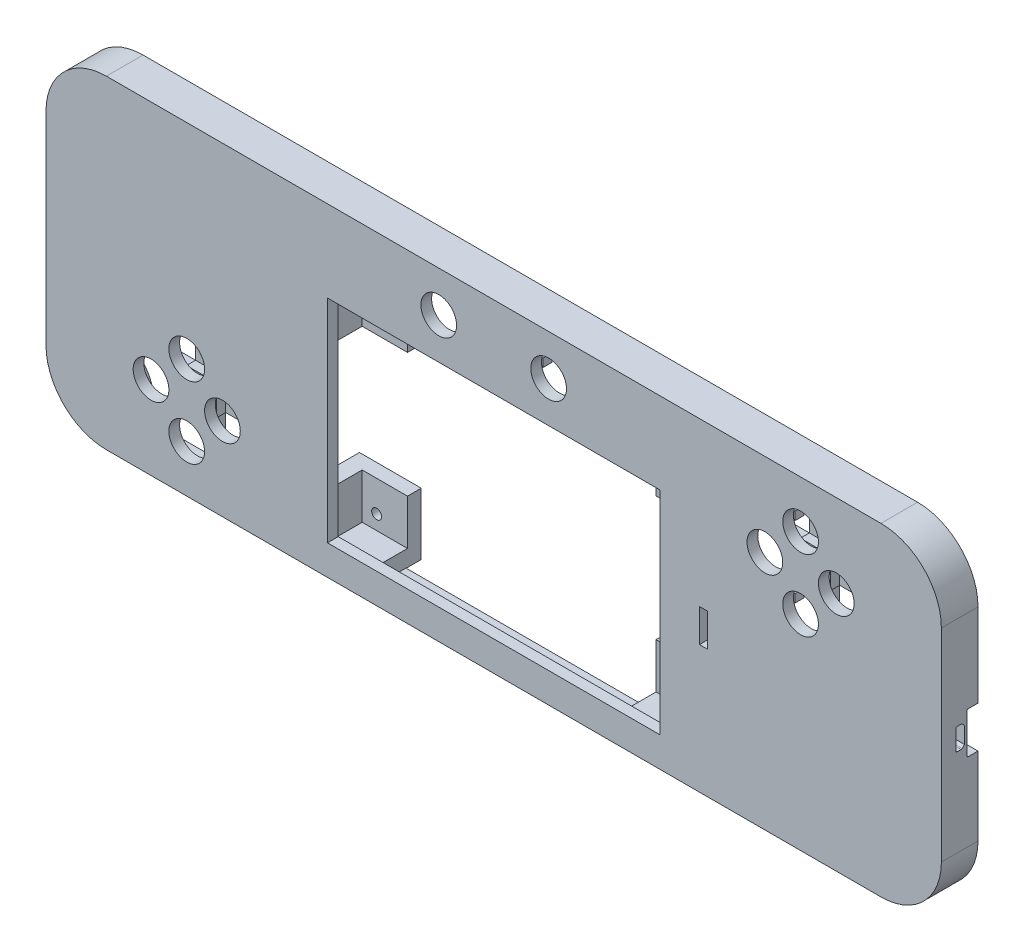
from build123d import *
from OCP.BRepAlgoAPI import BRepAlgoAPI_Cut
from OCP.TopTools import TopTools_ListOfShape

# Parameters (mm, degrees)
BOSS_EXTRUDE1_START  = 12
BOSS_EXTRUDE1_DEPTH  = 13.331287921
BOSS_EXTRUDE2_START  = 12
SKETCH1_3_W          = 121
SKETCH1_3_H          = 77.2
BOSS_EXTRUDE2_DEPTH  = 3.9
CUT_EXTRUDE1_START   = 12
SKETCH2_R            = 6.5
CUT_EXTRUDE1_DEPTH   = 3.9
CUT_EXTRUDE3_START   = 163.1
CUT_EXTRUDE3_DEPTH   = 3.9
CUT_EXTRUDE4_START   = 8.1
SKETCH5_W            = 70
SKETCH5_H            = 53.168839264
CUT_EXTRUDE4_DEPTH   = 1.8
BOSS_EXTRUDE3_START  = 8.1
BOSS_EXTRUDE3_DEPTH  = 15
BOSS_EXTRUDE4_START  = -6.9
SKETCH6_4_W          = 16.5
SKETCH6_4_H          = 16.5
SKETCH6_4_R          = 1.8
BOSS_EXTRUDE4_DEPTH  = 5
CUT_EXTRUDE5_START   = -59.9
SKETCH7_R            = 6.5
CUT_EXTRUDE5_DEPTH   = 3.9
BOSS_EXTRUDE7_START  = 8.1
SKETCH8_W            = 4
SKETCH8_H            = 3
SKETCH8_W_2          = 3
SKETCH8_H_2          = 4
SKETCH8_W_3          = 8
SKETCH8_H_3          = 4.95
BOSS_EXTRUDE7_DEPTH  = 3.3
BOSS_EXTRUDE8_START  = 4.8
SKETCH8_3_W          = 8
SKETCH8_3_H          = 5
SKETCH8_3_W_2        = 5
SKETCH8_3_H_2        = 8
SKETCH8_3_H_3        = 4
SKETCH8_3_H_4        = 4.95
BOSS_EXTRUDE8_DEPTH  = 3
BOSS_EXTRUDE9_START  = 9.9
SKETCH9_W            = 6.735111263
SKETCH9_H            = 18.572579543
SKETCH9_W_2          = 6.849276862
SKETCH9_H_2          = 17.65415528
BOSS_EXTRUDE9_DEPTH  = 5.88
BOSS_EXTRUDE10_START = 8.1
SKETCH9_4_W          = 7.5
SKETCH9_4_H          = 39.329891822
BOSS_EXTRUDE10_DEPTH = 4.88
CUT_EXTRUDE6_START   = 1.414648
SKETCH10_W           = 3
SKETCH10_H           = 12
CUT_EXTRUDE6_DEPTH   = 3.9
BOSS_EXTRUDE11_START = -1.331288
SKETCH11_R           = 4
BOSS_EXTRUDE11_DEPTH = 11.231288


with BuildPart() as part:
    # Sketch1 → Boss-Extrude1 (new body)
    with BuildSketch(Plane.XY.offset(BOSS_EXTRUDE1_START)):
        with BuildLine():
            Line((-162.9, -37.9), (-162.9, 35.9))
            ThreePointArc((-162.9, 35.9), (-156.456349186, 51.456349186), (-140.9, 57.9))
            Line((-140.9, 57.9), (141.1, 57.9))
            ThreePointArc((141.1, 57.9), (156.656349186, 51.456349186), (163.1, 35.9))
            Line((163.1, 35.9), (163.1, -37.9))
            ThreePointArc((163.1, -37.9), (156.656349186, -53.456349186), (141.1, -59.9))
            Line((141.1, -59.9), (-140.9, -59.9))
            ThreePointArc((-140.9, -59.9), (-156.456349186, -53.456349186), (-162.9, -37.9))
        make_face()
        with BuildLine():
            Line((137.2, -56), (-137, -56))
            ThreePointArc((-137, -56), (-152.556349186, -49.556349186), (-159, -34))
            Line((-159, -34), (-159, 32))
            ThreePointArc((-159, 32), (-152.556349186, 47.556349186), (-137, 54))
            Line((-137, 54), (137.2, 54))
            ThreePointArc((137.2, 54), (152.756349186, 47.556349186), (159.2, 32))
            Line((159.2, 32), (159.2, -34))
            ThreePointArc((159.2, -34), (152.756349186, -49.556349186), (137.2, -56))
        make_face(mode=Mode.SUBTRACT)
    extrude(amount=-BOSS_EXTRUDE1_DEPTH)

    # Sketch1<3> → Boss-Extrude2 (add)
    with BuildSketch(Plane.XY.offset(BOSS_EXTRUDE2_START)):
        with BuildLine():
            ThreePointArc((-137, -56), (-152.556349186, -49.556349186), (-159, -34))
            Line((-159, -34), (-159, 32))
            ThreePointArc((-159, 32), (-152.556349186, 47.556349186), (-137, 54))
            Line((-137, 54), (137.2, 54))
            ThreePointArc((137.2, 54), (152.756349186, 47.556349186), (159.2, 32))
            Line((159.2, 32), (159.2, -34))
            ThreePointArc((159.2, -34), (152.756349186, -49.556349186), (137.2, -56))
            Line((137.2, -56), (-137, -56))
        make_face()
        with Locations((0.073350115, -10.4)):
            Rectangle(SKETCH1_3_W, SKETCH1_3_H, mode=Mode.SUBTRACT)
    extrude(amount=-BOSS_EXTRUDE2_DEPTH)

    # Sketch2 → Cut-Extrude1 (cut)
    with BuildSketch(Plane.XY.offset(CUT_EXTRUDE1_START)):
        with Locations((111.836675057, 14.644432636)):
            Circle(SKETCH2_R)
        with Locations((98.836675057, 27.644432636)):
            Circle(SKETCH2_R)
        with Locations((111.836675057, 40.644432636)):
            Circle(SKETCH2_R)
        with Locations((124.836675057, 27.644432636)):
            Circle(SKETCH2_R)
        with Locations((20.1, 43.05)):
            Circle(SKETCH2_R)
        with Locations((-111.663324943, -42.644432636)):
            Circle(SKETCH2_R)
        with Locations((-124.663324943, -29.644432636)):
            Circle(SKETCH2_R)
        with Locations((-98.663324943, -29.644432636)):
            Circle(SKETCH2_R)
        with Locations((-111.663324943, -16.644432636)):
            Circle(SKETCH2_R)
        with Locations((-19.9, 43.05)):
            Circle(SKETCH2_R)
    extrude(amount=-CUT_EXTRUDE1_DEPTH, mode=Mode.SUBTRACT)

    # Sketch4 → Cut-Extrude3 (cut)
    with BuildSketch(Plane(origin=(0, 0, 0), x_dir=(0, 0, -1), z_dir=(1, 0, 0)).offset(CUT_EXTRUDE3_START)):
        with BuildLine():
            Line((-6.205473314, -6), (-4.820792559, -6))
            ThreePointArc((-4.820792559, -6), (-4.623827102, -5.962796787), (-4.454001452, -5.856313365))
            Line((-4.454001452, -5.856313365), (-3.605473314, -5.007785228))
            Line((-3.605473314, -5.007785228), (-3.605473314, 1.007785228))
            Line((-3.605473314, 1.007785228), (-4.454001452, 1.856313365))
            ThreePointArc((-4.454001452, 1.856313365), (-4.623827102, 1.962796787), (-4.820792559, 2))
            Line((-4.820792559, 2), (-6.205473314, 2))
            ThreePointArc((-6.205473314, 2), (-6.559026705, 1.853553391), (-6.705473314, 1.5))
            Line((-6.705473314, 1.5), (-6.705473314, -5.5))
            ThreePointArc((-6.705473314, -5.5), (-6.559026705, -5.853553391), (-6.205473314, -6))
        make_face()
        with BuildLine():
            Line((-2.698712079, -9.05), (-2.698712079, 5.05))
            ThreePointArc((-2.698712079, 5.05), (-2.552265469, 5.403553391), (-2.198712079, 5.55))
            Line((-2.198712079, 5.55), (4.705469512, 5.55))
            ThreePointArc((4.705469512, 5.55), (5.059022903, 5.403553391), (5.205469512, 5.05))
            Line((5.205469512, 5.05), (5.205469512, -9.05))
            ThreePointArc((5.205469512, -9.05), (5.059022903, -9.403553391), (4.705469512, -9.55))
            Line((4.705469512, -9.55), (-2.198712079, -9.55))
            ThreePointArc((-2.198712079, -9.55), (-2.552265469, -9.403553391), (-2.698712079, -9.05))
        make_face()
    extrude(amount=-CUT_EXTRUDE3_DEPTH, mode=Mode.SUBTRACT)

    # Sketch5 → Cut-Extrude4 (cut)
    with BuildSketch(Plane.XY.offset(CUT_EXTRUDE4_START)):
        with Locations((115.058285802, -19.439852927)):
            Rectangle(SKETCH5_W, SKETCH5_H)
    extrude(amount=CUT_EXTRUDE4_DEPTH, mode=Mode.SUBTRACT)

    # Sketch6 → Boss-Extrude3 (add)
    with BuildSketch(Plane.XY.offset(BOSS_EXTRUDE3_START)):
        Polygon((45.323350115, 28.2), (61.823350115, 28.2), (61.823350115, 11.7), (67.823350115, 11.7), (67.823350115, 34.2), (45.323350115, 34.2), align=None)
        Polygon((-45.176649885, 28.2), (-45.176649885, 34.2), (-67.676649885, 34.2), (-67.676649885, 11.7), (-61.676649885, 11.7), (-61.676649885, 28.2), align=None)
        Polygon((-61.676649885, -50.1), (-61.676649885, -33.6), (-67.676649885, -33.6), (-67.676649885, -56.1), (-45.176649885, -56.1), (-45.176649885, -50.1), align=None)
        Polygon((67.823350115, -56.1), (67.823350115, -33.6), (61.823350115, -33.6), (61.823350115, -50.1), (45.323350115, -50.1), (45.323350115, -56.1), align=None)
    extrude(amount=-BOSS_EXTRUDE3_DEPTH)

    # Sketch6<4> → Boss-Extrude4 (add)
    # profile 1 of 4: a face of its own
    with BuildSketch(Plane.XY.offset(BOSS_EXTRUDE4_START)):
        with Locations((-53.426649885, 19.95)):
            Rectangle(SKETCH6_4_W, SKETCH6_4_H)
        with Locations((-56.426649885, 22.95)):
            Circle(SKETCH6_4_R, mode=Mode.SUBTRACT)
    # profile 2 of 4: a face of its own
    with BuildSketch(Plane.XY.offset(BOSS_EXTRUDE4_START)):
        with Locations((-53.426649885, -41.85)):
            Rectangle(SKETCH6_4_W, SKETCH6_4_H)
        with Locations((-56.426649885, -44.85)):
            Circle(SKETCH6_4_R, mode=Mode.SUBTRACT)
    # profile 3 of 4: a face of its own
    with BuildSketch(Plane.XY.offset(BOSS_EXTRUDE4_START)):
        with Locations((53.573350115, -41.85)):
            Rectangle(SKETCH6_4_W, SKETCH6_4_H)
        with Locations((56.573350115, -44.85)):
            Circle(SKETCH6_4_R, mode=Mode.SUBTRACT)
    # profile 4 of 4: a face of its own
    with BuildSketch(Plane.XY.offset(BOSS_EXTRUDE4_START)):
        with Locations((53.573350115, 19.95)):
            Rectangle(SKETCH6_4_W, SKETCH6_4_H)
        with Locations((56.573350115, 22.95)):
            Circle(SKETCH6_4_R, mode=Mode.SUBTRACT)
    extrude(amount=BOSS_EXTRUDE4_DEPTH)

    # Sketch7 → Cut-Extrude5 (cut)
    with BuildSketch(Plane(origin=(0, 0, 0), x_dir=(1, 0, 0), z_dir=(0, 1, 0)).offset(CUT_EXTRUDE5_START)):
        with Locations((-94.9, 4.665643961)):
            Circle(SKETCH7_R)
        with Locations((95.1, 4.665643961)):
            Circle(SKETCH7_R)
    extrude(amount=CUT_EXTRUDE5_DEPTH, mode=Mode.SUBTRACT)

    # Sketch8 → Boss-Extrude7 (add)
    with BuildSketch(Plane.XY.offset(BOSS_EXTRUDE7_START)):
        Polygon((118.836675057, 23.644432636), (118.836675057, 31.644432636), (115.836675057, 31.644432636), (115.836675057, 34.644432636), (107.836675057, 34.644432636), (107.836675057, 31.644432636), (104.836675057, 31.644432636), (104.836675057, 23.644432636), (107.836675057, 23.644432636), (107.836675057, 20.644432636), (115.836675057, 20.644432636), (115.836675057, 23.644432636), align=None)
        with Locations((103.836675057, 14.644432636)):
            Rectangle(SKETCH8_W, SKETCH8_H)
        with Locations((98.836675057, 35.644432636)):
            Rectangle(SKETCH8_W_2, SKETCH8_H_2)
        with Locations((103.836675057, 40.644432636)):
            Rectangle(SKETCH8_W, SKETCH8_H)
        with Locations((124.836675057, 35.644432636)):
            Rectangle(SKETCH8_W_2, SKETCH8_H_2)
        with Locations((-103.663324943, -42.644432636)):
            Rectangle(SKETCH8_W, SKETCH8_H)
        with Locations((-98.663324943, -21.644432636)):
            Rectangle(SKETCH8_W_2, SKETCH8_H_2)
        with Locations((-103.663324943, -16.644432636)):
            Rectangle(SKETCH8_W, SKETCH8_H)
        with Locations((-124.663324943, -21.644432636)):
            Rectangle(SKETCH8_W_2, SKETCH8_H_2)
        Polygon((-115.663324943, -22.644432636), (-115.663324943, -25.644432636), (-118.663324943, -25.644432636), (-118.663324943, -33.644432636), (-115.663324943, -33.644432636), (-115.663324943, -36.644432636), (-107.663324943, -36.644432636), (-107.663324943, -33.644432636), (-104.663324943, -33.644432636), (-104.663324943, -25.644432636), (-107.663324943, -25.644432636), (-107.663324943, -22.644432636), align=None)
        with Locations((-11.9, 43.05)):
            Rectangle(SKETCH8_W, SKETCH8_H)
        with Locations((12.1, 43.05)):
            Rectangle(SKETCH8_W, SKETCH8_H)
        with Locations((20.1, 51.525)):
            Rectangle(SKETCH8_W_3, SKETCH8_H_3)
        with Locations((-19.9, 51.525)):
            Rectangle(SKETCH8_W_3, SKETCH8_H_3)
    extrude(amount=-BOSS_EXTRUDE7_DEPTH)

    # Sketch8<3> → Boss-Extrude8 (add)
    with BuildSketch(Plane.XY.offset(BOSS_EXTRUDE8_START)):
        with Locations((111.836675057, 18.144432636)):
            Rectangle(SKETCH8_3_W, SKETCH8_3_H)
        with Locations((121.336675057, 27.644432636)):
            Rectangle(SKETCH8_3_W_2, SKETCH8_3_H_2)
        with Locations((102.336675057, 27.644432636)):
            Rectangle(SKETCH8_3_W_2, SKETCH8_3_H_2)
        with Locations((111.836675057, 37.144432636)):
            Rectangle(SKETCH8_3_W, SKETCH8_3_H)
        Polygon((118.836675057, 23.644432636), (118.836675057, 31.644432636), (115.836675057, 31.644432636), (115.836675057, 34.644432636), (107.836675057, 34.644432636), (107.836675057, 31.644432636), (104.836675057, 31.644432636), (104.836675057, 23.644432636), (107.836675057, 23.644432636), (107.836675057, 20.644432636), (115.836675057, 20.644432636), (115.836675057, 23.644432636), align=None)
        with Locations((-121.163324943, -29.644432636)):
            Rectangle(SKETCH8_3_W_2, SKETCH8_3_H_2)
        with Locations((-102.163324943, -29.644432636)):
            Rectangle(SKETCH8_3_W_2, SKETCH8_3_H_2)
        with Locations((-111.663324943, -39.144432636)):
            Rectangle(SKETCH8_3_W, SKETCH8_3_H)
        with Locations((-111.663324943, -20.144432636)):
            Rectangle(SKETCH8_3_W, SKETCH8_3_H)
        Polygon((-115.663324943, -22.644432636), (-115.663324943, -25.644432636), (-118.663324943, -25.644432636), (-118.663324943, -33.644432636), (-115.663324943, -33.644432636), (-115.663324943, -36.644432636), (-107.663324943, -36.644432636), (-107.663324943, -33.644432636), (-104.663324943, -33.644432636), (-104.663324943, -25.644432636), (-107.663324943, -25.644432636), (-107.663324943, -22.644432636), align=None)
        with Locations((-19.9, 47.05)):
            Rectangle(SKETCH8_3_W, SKETCH8_3_H_3)
        with Locations((-19.9, 51.525)):
            Rectangle(SKETCH8_3_W, SKETCH8_3_H_4)
        with Locations((20.1, 47.05)):
            Rectangle(SKETCH8_3_W, SKETCH8_3_H_3)
        with Locations((20.1, 51.525)):
            Rectangle(SKETCH8_3_W, SKETCH8_3_H_4)
    extrude(amount=-BOSS_EXTRUDE8_DEPTH)

    # Sketch9 → Boss-Extrude9 (add)
    with BuildSketch(Plane.XY.offset(BOSS_EXTRUDE9_START)):
        with Locations((80.09191074, 4.460146993)):
            Rectangle(SKETCH9_W, SKETCH9_H)
        with Locations((155.775361569, -15.388021805)):
            Rectangle(SKETCH9_W_2, SKETCH9_H_2)
    extrude(amount=-BOSS_EXTRUDE9_DEPTH)

    # Sketch9<4> → Boss-Extrude10 (add)
    with BuildSketch(Plane.XY.offset(BOSS_EXTRUDE10_START)):
        with Locations((71.573350115, -25.185054089)):
            Rectangle(SKETCH9_4_W, SKETCH9_4_H)
    extrude(amount=-BOSS_EXTRUDE10_DEPTH)


with BuildPart() as cut_extrude6_tool:
    # Sketch10 → Cut-Extrude6 (new body)
    with BuildSketch(Plane(origin=(0.073350115, -1, 10.585352353), x_dir=(1, 0, 0), z_dir=(0, 0, 1)).offset(CUT_EXTRUDE6_START)):
        with Locations((76.448833599, -6.358991056)):
            Rectangle(SKETCH10_W, SKETCH10_H)
    extrude(amount=-CUT_EXTRUDE6_DEPTH)


with BuildPart() as part_1:
    add(part.part)

    # Cut-Extrude6: cut by cut_extrude6_tool, with a tolerance
    cut_extrude6_stock = TopTools_ListOfShape()
    cut_extrude6_stock.Append(part_1.part.wrapped)
    cut_extrude6_tools = TopTools_ListOfShape()
    cut_extrude6_tools.Append(cut_extrude6_tool.part.wrapped)
    cut_extrude6_cut = BRepAlgoAPI_Cut()
    cut_extrude6_cut.SetArguments(cut_extrude6_stock)
    cut_extrude6_cut.SetTools(cut_extrude6_tools)
    cut_extrude6_cut.SetFuzzyValue(0.00001)
    cut_extrude6_cut.Build()
    add(Compound.cast(cut_extrude6_cut.Shape()).solids(), mode=Mode.REPLACE)

    # Sketch11 → Boss-Extrude11 (add)
    # profile 1 of 4: a face of its own
    with BuildSketch(Plane.XY.offset(BOSS_EXTRUDE11_START)):
        with BuildLine():
            ThreePointArc((-159, -34), (-152.556349186, -49.556349186), (-137, -56))
            Line((-137, -56), (-137, -49))
            ThreePointArc((-137, -49), (-141.393398282, -38.393398282), (-152, -34))
            Line((-152, -34), (-159, -34))
        make_face()
        with Locations((-146.728174593, -43.728174593)):
            Circle(SKETCH11_R, mode=Mode.SUBTRACT)
    # profile 2 of 4: a face of its own
    with BuildSketch(Plane.XY.offset(BOSS_EXTRUDE11_START)):
        with BuildLine():
            Line((137.2, -49), (137.2, -56))
            ThreePointArc((137.2, -56), (152.756349186, -49.556349186), (159.2, -34))
            Line((159.2, -34), (152.2, -34))
            ThreePointArc((152.2, -34), (141.593398282, -38.393398282), (137.2, -49))
        make_face()
        with Locations((146.728174593, -43.728174593)):
            Circle(SKETCH11_R, mode=Mode.SUBTRACT)
    # profile 3 of 4: a face of its own
    with BuildSketch(Plane.XY.offset(BOSS_EXTRUDE11_START)):
        with BuildLine():
            ThreePointArc((-137, 54), (-152.556349186, 47.556349186), (-159, 32))
            Line((-159, 32), (-152, 32))
            ThreePointArc((-152, 32), (-141.393398282, 36.393398282), (-137, 47))
            Line((-137, 47), (-137, 54))
        make_face()
        with Locations((-146.728174593, 41.728174593)):
            Circle(SKETCH11_R, mode=Mode.SUBTRACT)
    # profile 4 of 4: a face of its own
    with BuildSketch(Plane.XY.offset(BOSS_EXTRUDE11_START)):
        with BuildLine():
            ThreePointArc((137.2, 47), (141.593398282, 36.393398282), (152.2, 32))
            Line((152.2, 32), (159.2, 32))
            ThreePointArc((159.2, 32), (152.756349186, 47.556349186), (137.2, 54))
            Line((137.2, 54), (137.2, 47))
        make_face()
        with Locations((146.728174593, 41.728174593)):
            Circle(SKETCH11_R, mode=Mode.SUBTRACT)
    extrude(amount=BOSS_EXTRUDE11_DEPTH)


solid = part_1.part
